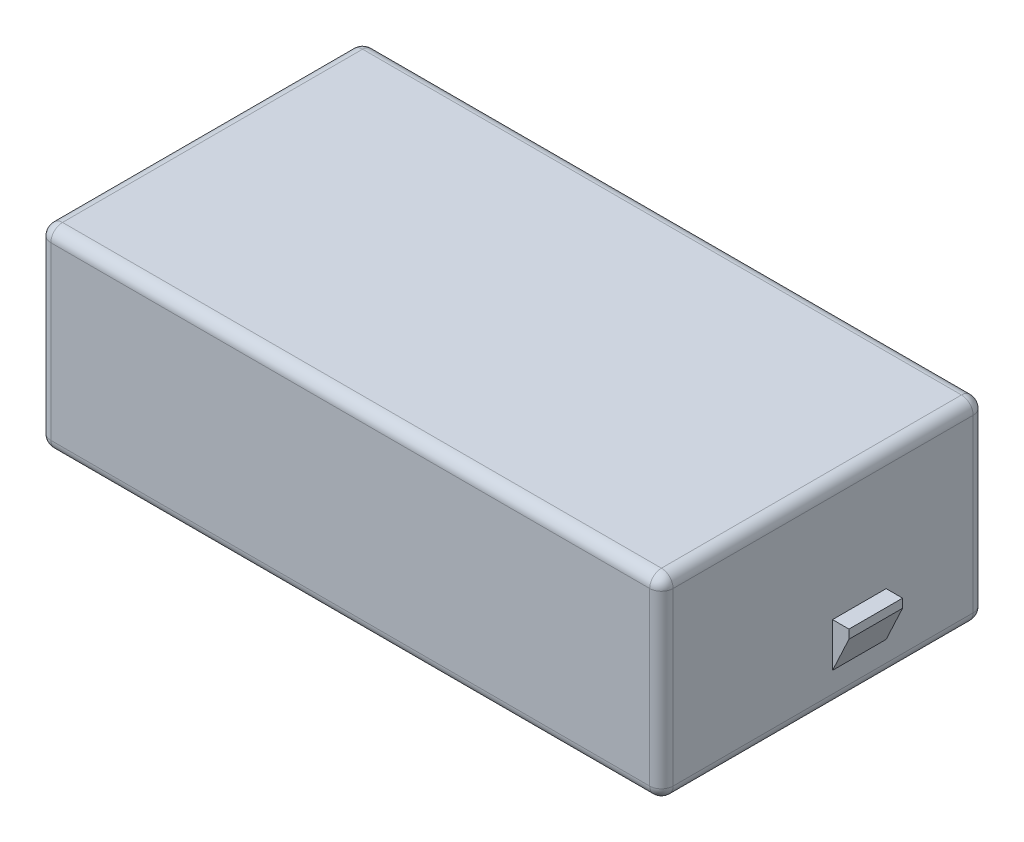
from build123d import *

# Parameters (mm, degrees)
SCHIZZO1_W                   = 106.2
SCHIZZO1_H                   = 33.2
ESTRUSIONE_ESTRUSIONE1_DEPTH = 55.2
RACCORDO1_R                  = 2
SCHIZZO2_W                   = 12
SCHIZZO2_H                   = 13
ESTRUSIONE_ESTRUSIONE2_DEPTH = 6
SMUSSO1_SIZE2                = 10
SMUSSO1_SIZE                 = 6
SCHIZZO4_W                   = 9.15
SCHIZZO4_H                   = 7.5
ESTRUSIONE_ESTRUSIONE3_DEPTH = 2.8
SMUSSO2_SIZE2                = 6
SMUSSO2_SIZE                 = 2.8
SCHIZZO5_W                   = 25.4
SCHIZZO5_H                   = 16
ESTRUSIONE_ESTRUSIONE4_DEPTH = 2.5


with BuildPart() as part:
    # Schizzo1 → Estrusione-Estrusione1 (new body)
    with BuildSketch(Plane.XY):
        with Locations((1.864332707, 11.26679198)):
            Rectangle(SCHIZZO1_W, SCHIZZO1_H)
    extrude(amount=ESTRUSIONE_ESTRUSIONE1_DEPTH)

    # Raccordo1
    raccordo1_edges = [part.edges().sort_by_distance(p)[0] for p in [
        (54.964332707, 11.26679198, 55.2),
        (1.864332707, 27.86679198, 55.2),
        (-51.235667293, 11.26679198, 55.2),
        (1.864332707, 27.86679198, 0),
        (54.964332707, 11.26679198, 0),
        (1.864332707, -5.33320802, 0),
        (-51.235667293, 11.26679198, 0),
        (1.864332707, -5.33320802, 55.2),
        (-51.235667293, 27.86679198, 27.6),
        (54.964332707, 27.86679198, 27.6),
        (54.964332707, -5.33320802, 27.6),
        (-51.235667293, -5.33320802, 27.6),
    ]]
    fillet(raccordo1_edges, radius=RACCORDO1_R)

    # Schizzo2 → Estrusione-Estrusione2 (add)
    with BuildSketch(Plane.ZY.offset(51.235667293)):
        with Locations((42, 13.16679198)):
            Rectangle(SCHIZZO2_W, SCHIZZO2_H)
    extrude(amount=ESTRUSIONE_ESTRUSIONE2_DEPTH)

    # Smusso1
    smusso1_edges = [part.edges().sort_by_distance(p)[0] for p in [
        (-57.235667293, 6.66679198, 42),
    ]]
    smusso1_side = [part.faces().sort_by_distance(p)[0] for p in [
        (-57.115667293, 6.66679198, 42),
    ]]
    chamfer(smusso1_edges, length=SMUSSO1_SIZE - 0.0001, length2=SMUSSO1_SIZE2 - 0.0001, reference=smusso1_side[0])  # a hair under: the kernel refuses the full size

    # Schizzo4 → Estrusione-Estrusione3 (add)
    with BuildSketch(Plane(origin=(54.964332707, 0, 0), x_dir=(0, 0, -1), z_dir=(1, 0, 0))):
        with Locations((-21.425, 3.91679198)):
            Rectangle(SCHIZZO4_W, SCHIZZO4_H)
    extrude(amount=ESTRUSIONE_ESTRUSIONE3_DEPTH)

    # Smusso2
    smusso2_edges = [part.edges().sort_by_distance(p)[0] for p in [
        (57.764332707, 0.16679198, 21.425),
    ]]
    smusso2_side = [part.faces().sort_by_distance(p)[0] for p in [
        (57.708332707, 0.16679198, 21.425),
    ]]
    chamfer(smusso2_edges, length=SMUSSO2_SIZE - 0.0001, length2=SMUSSO2_SIZE2 - 0.0001, reference=smusso2_side[0])  # a hair under: the kernel refuses the full size

    # Schizzo5 → Estrusione-Estrusione4 (add)
    with BuildSketch(Plane(origin=(0, 0, 0), x_dir=(-1, 0, 0), z_dir=(0, 0, -1))):
        with Locations((31.935667293, 15.86679198)):
            Rectangle(SCHIZZO5_W, SCHIZZO5_H)
    extrude(amount=ESTRUSIONE_ESTRUSIONE4_DEPTH)


solid = part.part
